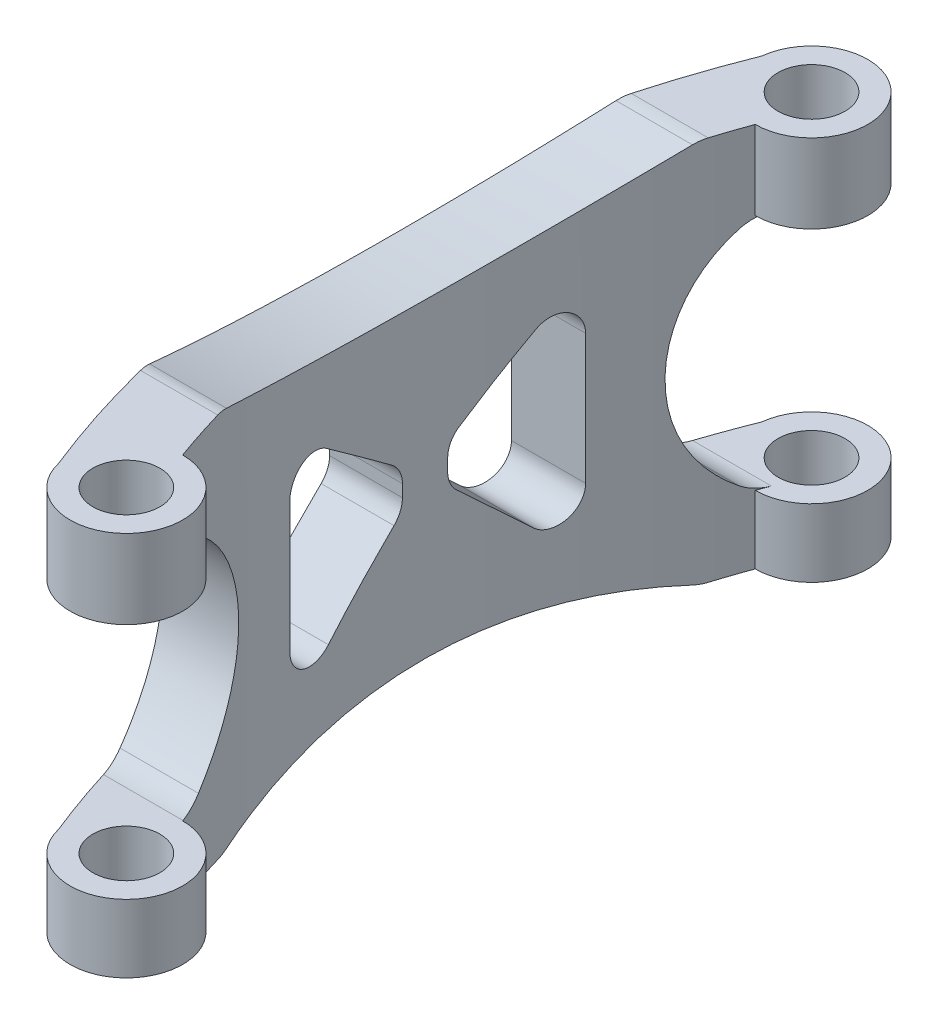
from build123d import *

# Parameters (mm, degrees)
SKETCH1_R           = 3.175
BOSS_EXTRUDE1_DEPTH = 36.465836796
CUT_EXTRUDE4_DEPTH  = 38.1
FILLET1_R           = 2.54
FILLET2_R           = 3.81


with BuildPart() as part:
    # Sketch1 → Boss-Extrude1 (new body)
    with BuildSketch(Plane(origin=(0, -77.079667224, 0), x_dir=(1, 0, 0), z_dir=(0, 1, 0))):
        with BuildLine():
            ThreePointArc((6.629573902, 141.6706294), (10.61106623, 150.554175123), (1.33055288, 147.614491853))
            ThreePointArc((1.33055288, 147.614491853), (-5.037804866, 114.23399198), (1.439421654, 80.874446288))
            ThreePointArc((1.439421654, 80.874446288), (10.813739956, 78.796624207), (6.629573902, 87.438842826))
            ThreePointArc((6.629573902, 87.438842826), (1.857066942, 114.554736113), (6.629573902, 141.6706294))
        make_face()
        with Locations(Location((6.629573902, 147.0046294, 0), (0, 0, 90))):
            Circle(SKETCH1_R, mode=Mode.SUBTRACT)
        with Locations(Location((6.629573902, 82.104842826, 0), (0, 0, 90))):
            Circle(SKETCH1_R, mode=Mode.SUBTRACT)
    extrude(amount=BOSS_EXTRUDE1_DEPTH)

    # Sketch2 → Cut-Extrude4 (cut)
    with BuildSketch(Plane.ZY.offset(-14.989708743)):
        with BuildLine():
            Line((-141.6706294, -48.096203298), (-158.27924431, -48.096203298))
            Line((-158.27924431, -48.096203298), (-158.27924431, -70.631054448))
            Line((-158.27924431, -70.631054448), (-141.6706294, -70.631054448))
            ThreePointArc((-141.6706294, -70.631054448), (-135.175118525, -59.363628873), (-141.6706294, -48.096203298))
        make_face()
        with BuildLine():
            Line((-88.606531181, -48.096203298), (-71.997916271, -48.096203298))
            Line((-71.997916271, -48.096203298), (-71.997916271, -70.631054448))
            Line((-71.997916271, -70.631054448), (-88.606531181, -70.631054448))
            ThreePointArc((-88.606531181, -70.631054448), (-95.102042056, -59.363628873), (-88.606531181, -48.096203298))
        make_face()
        Polygon((-129.044758215, -48.096203298), (-129.044758215, -71.256742142), (-117.266413233, -60.398540104), (-117.266413233, -56.854665015), align=None)
        Polygon((-101.232402366, -71.256742142), (-113.010747348, -60.398540104), (-113.010747348, -56.854665015), (-101.232402366, -48.096203298), align=None)
        with BuildLine():
            Line((-137.753126984, -77.079667224), (-137.753126984, -80.724268174))
            Line((-137.753126984, -80.724268174), (-92.971695738, -80.724268174))
            Line((-92.971695738, -80.724268174), (-92.971695738, -77.079667224))
            ThreePointArc((-92.971695738, -77.079667224), (-115.362411361, -73.557428449), (-137.753126984, -77.079667224))
        make_face()
        with BuildLine():
            Line((-92.971695738, -36.969229478), (-92.971695738, -40.613830428))
            ThreePointArc((-92.971695738, -40.613830428), (-115.362411361, -44.136069203), (-137.753126984, -40.613830428))
            Line((-137.753126984, -40.613830428), (-137.753126984, -36.969229478))
            Line((-137.753126984, -36.969229478), (-92.971695738, -36.969229478))
        make_face()
    extrude(amount=CUT_EXTRUDE4_DEPTH, mode=Mode.SUBTRACT)

    # Fillet1
    fillet1_edges = [part.edges().sort_by_distance(p)[0] for p in [
        (-0.321879236, -71.256742142, -129.044758215),
        (-0.321879236, -48.096203298, -129.044758215),
        (-1.544110677, -60.398540104, -117.266413233),
        (-1.544110677, -56.854665015, -117.266413233),
        (-1.577704882, -60.398540104, -113.010747348),
        (-1.577704882, -56.854665015, -113.010747348),
        (-0.54439329, -71.256742142, -101.232402366),
        (-0.54439329, -48.096203298, -101.232402366),
    ]]
    fillet(fillet1_edges, radius=FILLET1_R)

    # Fillet2
    # the kernel refuses this fillet: 3.81 mm, written as the material it adds along each edge
    with BuildSketch(Plane(origin=(9.95749855, -48.096203298, -141.6706294), x_dir=(0, 0, -1), z_dir=(-1, 0, 0))) as fillet2_piece_1_section:
        with BuildLine():
            CenterArc((1.119591581, 3.81), FILLET2_R, 234.065298784, 35.934701216)
            ThreePointArc((-1.116355882, 0.725094987), (-0.567450563, 0.348271368), (0, 0))
            Line((0, 0), (1.119591581, 0))
        make_face()
    fillet2_piece_1 = extrude(amount=14.081170411, mode=Mode.PRIVATE)
    fillet2_piece_1 = fillet2_piece_1 & Plane(origin=(84.861623245, -48.249412482, -114.380639175), x_dir=(-0.929160073483065, 0, -0.3696776404449498), z_dir=(0, -1, 0)) * Cylinder(89.89954772, 33, mode=Mode.PRIVATE)
    fillet2_piece_1 = fillet2_piece_1 - Plane(origin=(81.275336822, -48.249412482, -114.554736113), x_dir=(-0.9399066868777819, 0, 0.3414314279067341), z_dir=(0, -1, 0)) * Cylinder(79.41826988, 33, mode=Mode.PRIVATE)
    add(fillet2_piece_1)
    with BuildSketch(Plane(origin=(9.95749855, -70.631054448, -141.6706294), x_dir=(0, 0.5447050814150162, 0.8386276732141985), z_dir=(-1, 0, 0))) as fillet2_piece_2_section:
        with BuildLine():
            CenterArc((1.136405877, 3.805018658), FILLET2_R, 236.995487767, 35.934701216)
            Line((-0.938920483, 0.609847224), (0, 0))
            ThreePointArc((0, 0), (0.66558493, -0.017023198), (1.331169859, 0))
        make_face()
    fillet2_piece_2 = extrude(amount=14.081170411, mode=Mode.PRIVATE)
    fillet2_piece_2 = fillet2_piece_2 & Plane(origin=(84.861623245, -70.477845816, -114.380639175), x_dir=(-0.929160073483065, 0, -0.3696776404449498), z_dir=(0, -1, 0)) * Cylinder(89.89954772, 34, mode=Mode.PRIVATE)
    fillet2_piece_2 = fillet2_piece_2 - Plane(origin=(81.275336822, -70.477845816, -114.554736113), x_dir=(-0.9399066868777819, 0, 0.3414314279067341), z_dir=(0, -1, 0)) * Cylinder(79.41826988, 34, mode=Mode.PRIVATE)
    add(fillet2_piece_2)
    with BuildSketch(Plane(origin=(9.543603521, -70.631054448, -88.606531181), x_dir=(0, 0, 1), z_dir=(-1, 0, 0))) as fillet2_piece_3_section:
        with BuildLine():
            CenterArc((1.119591581, 3.81), FILLET2_R, 234.065298784, 35.934701216)
            ThreePointArc((-1.116355882, 0.725094987), (-0.567450563, 0.348271368), (0, 0))
            Line((0, 0), (1.119591581, 0))
        make_face()
    fillet2_piece_3 = extrude(amount=14.135534311, mode=Mode.PRIVATE)
    fillet2_piece_3 = fillet2_piece_3 & Plane(origin=(84.861623245, -70.490011053, -114.380639175), x_dir=(-0.929160073483065, 0, -0.3696776404449498), z_dir=(0, -1, 0)) * Cylinder(89.89954772, 33, mode=Mode.PRIVATE)
    fillet2_piece_3 = fillet2_piece_3 - Plane(origin=(81.275336822, -70.490011053, -114.554736113), x_dir=(-0.9399066868777819, 0, 0.3414314279067341), z_dir=(0, -1, 0)) * Cylinder(79.41826988, 33, mode=Mode.PRIVATE)
    add(fillet2_piece_3)
    with BuildSketch(Plane(origin=(9.543603521, -48.096203298, -88.606531181), x_dir=(0, -0.5447050814150173, -0.8386276732141977), z_dir=(-1, 0, 0))) as fillet2_piece_4_section:
        with BuildLine():
            CenterArc((1.136405877, 3.805018658), FILLET2_R, 236.995487767, 35.934701216)
            Line((-0.938920483, 0.609847224), (0, 0))
            ThreePointArc((0, 0), (0.66558493, -0.017023198), (1.331169859, 0))
        make_face()
    fillet2_piece_4 = extrude(amount=14.135534311, mode=Mode.PRIVATE)
    fillet2_piece_4 = fillet2_piece_4 & Plane(origin=(84.861623245, -48.237246905, -114.380639175), x_dir=(-0.929160073483065, 0, -0.3696776404449498), z_dir=(0, -1, 0)) * Cylinder(89.89954772, 34, mode=Mode.PRIVATE)
    fillet2_piece_4 = fillet2_piece_4 - Plane(origin=(81.275336822, -48.237246905, -114.554736113), x_dir=(-0.9399066868777819, 0, 0.3414314279067341), z_dir=(0, -1, 0)) * Cylinder(79.41826988, 34, mode=Mode.PRIVATE)
    add(fillet2_piece_4)
    # the kernel refuses this fillet: 3.81 mm, written as the material it takes off along each edge
    with BuildSketch(Plane(origin=(6.324887144, -77.079667224, -92.971695738), x_dir=(0, 0.3032535927490975, -0.9529098900130928), z_dir=(-1, 0, 0))) as fillet2_2_piece_1:
        with BuildLine():
            CenterArc((0.591721573, -3.809970224), FILLET2_R, 90.226521401, 17.426605273)
            Line((-0.563674615, -0.179383543), (0, 0))
            ThreePointArc((0, 0), (0.288329304, -0.000569962), (0.576658609, 0))
        make_face()
    extrude(amount=10.25523649, mode=Mode.SUBTRACT)
    with BuildSketch(Plane(origin=(6.799594347, -77.079667224, -137.753126984), x_dir=(0, 0, -1), z_dir=(-1, 0, 0))) as fillet2_2_piece_2:
        with BuildLine():
            CenterArc((0.591529819, -3.81), FILLET2_R, 90, 17.426605273)
            ThreePointArc((-0.549503691, -0.174873795), (-0.274579003, -0.08798002), (0, 0))
            Line((0, 0), (0.591529819, 0))
        make_face()
    extrude(amount=10.224949034, mode=Mode.SUBTRACT)
    with BuildSketch(Plane(origin=(6.799594349, -40.613830428, -137.753126985), x_dir=(0, -0.30325359275828295, 0.9529098900101696), z_dir=(-1, 0, 0))) as fillet2_2_piece_3:
        with BuildLine():
            CenterArc((0.591721573, -3.809970224), FILLET2_R, 90.226521401, 17.426605273)
            Line((-0.563674615, -0.179383543), (0, 0))
            ThreePointArc((0, 0), (0.288329304, -0.000569962), (0.576658609, 0))
        make_face()
    extrude(amount=10.224949037, mode=Mode.SUBTRACT)
    with BuildSketch(Plane(origin=(6.324887145, -40.613830428, -92.971695737), x_dir=(0, 0, 1), z_dir=(-1, 0, 0))) as fillet2_2_piece_4:
        with BuildLine():
            CenterArc((0.591529819, -3.81), FILLET2_R, 90, 17.426605273)
            ThreePointArc((-0.549503691, -0.174873795), (-0.274579003, -0.08798002), (0, 0))
            Line((0, 0), (0.591529819, 0))
        make_face()
    extrude(amount=10.255236493, mode=Mode.SUBTRACT)


solid = part.part
